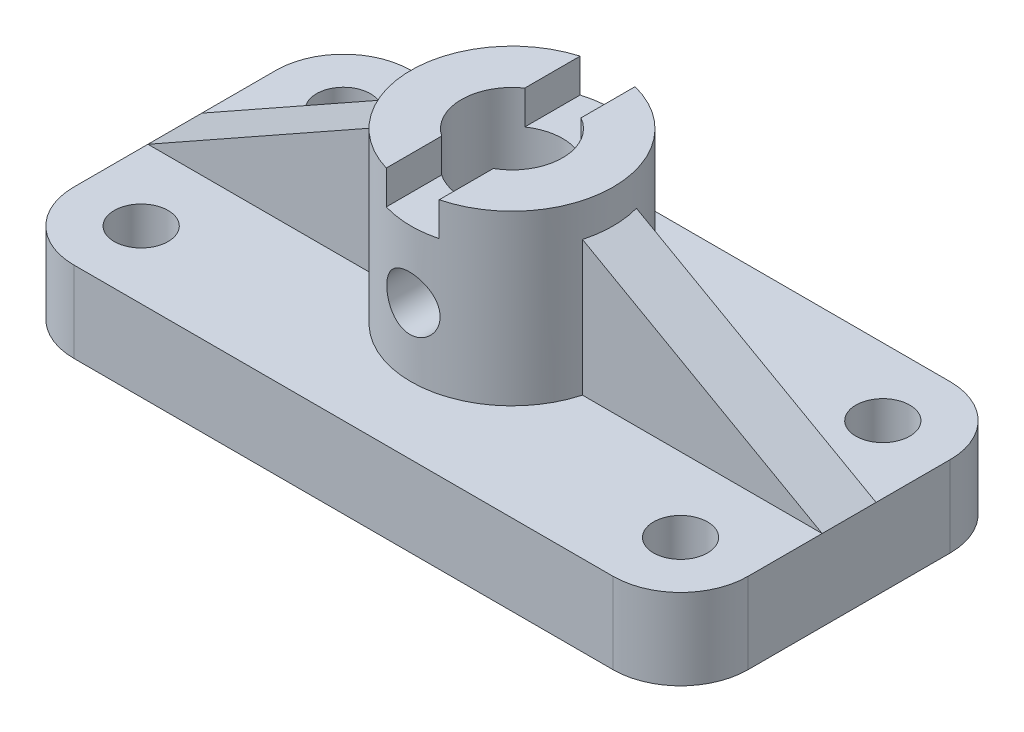
from build123d import *
from build123d.topology import SkipClean

# Parameters (mm, degrees)
SKETCH_1_R          = 4
EXTRUDE_1_DEPTH     = 12
EXTRUDE_3_DEPTH     = 25
CUT_EXTRUDE_START   = -5
CUT_EXTRUDE_2_DEPTH = 5
SKETCH_6_R          = 4
SKETCH_6_W          = 8
SKETCH_6_H          = 5
CUT_EXTRUDE_3_DEPTH = 69.62944
SKETCH_10_R         = 7.5
CUT_EXTRUDE_4_DEPTH = 68.037303


with BuildPart() as part:
    # 草图1 → 凸台-拉伸1 (new body)
    with BuildSketch(Plane(origin=(0, 0, 0), x_dir=(1, 0, 0), z_dir=(0, 1, 0))):
        with BuildLine():
            ThreePointArc((-40, 25), (-47.071068, 22.071068), (-50, 15))
            Line((-50, 15), (-50, -15))
            ThreePointArc((-50, -15), (-47.071068, -22.071068), (-40, -25))
            Line((-40, -25), (40, -25))
            ThreePointArc((40, -25), (47.071068, -22.071068), (50, -15))
            Line((50, -15), (50, 15))
            ThreePointArc((50, 15), (47.071068, 22.071068), (40, 25))
            Line((40, 25), (-40, 25))
        make_face()
        with Locations((-40, -15)):
            Circle(SKETCH_1_R, mode=Mode.SUBTRACT)
        with Locations((40, -15)):
            Circle(SKETCH_1_R, mode=Mode.SUBTRACT)
        with Locations((-40, 15)):
            Circle(SKETCH_1_R, mode=Mode.SUBTRACT)
        with Locations((40, 15)):
            Circle(SKETCH_1_R, mode=Mode.SUBTRACT)
    extrude(amount=EXTRUDE_1_DEPTH)

    # 草图3 → 凸台-拉伸3 (add)
    with BuildSketch(Plane(origin=(0, 12, 0), x_dir=(1, 0, 0), z_dir=(0, 1, 0))):
        with BuildLine():
            Line((-50, -4), (-14.456832, -4))
            ThreePointArc((-14.456832, -4), (15, 0), (-14.456832, 4))
            Line((-14.456832, 4), (-50, 4))
            Line((-50, 4), (-50, -4))
        make_face()
    extrude_3 = extrude(amount=EXTRUDE_3_DEPTH)

    # 草图7 → 切除-拉伸2 (cut)
    with SkipClean():  # the faces are left unmerged after this step: merging them gives an invalid solid
        with BuildSketch(Plane(origin=(0, 37, 0), x_dir=(1, 0, 0), z_dir=(0, 1, 0)).offset(CUT_EXTRUDE_START)):
            with BuildLine():
                Line((-14.456832, 4), (-50, 4))
                Line((-50, 4), (-50, -4))
                Line((-50, -4), (-14.456832, -4))
                ThreePointArc((-14.456832, -4), (-15, 0), (-14.456832, 4))
            make_face()
        cut_extrude_2 = extrude(amount=CUT_EXTRUDE_2_DEPTH, mode=Mode.SUBTRACT)

    # 草图6 → 切除-拉伸3 (cut, symmetric)
    with SkipClean():  # the faces are left unmerged after this step: merging them gives an invalid solid
        with BuildSketch(Plane.XY.offset(4)):
            with Locations((0.161482, 22)):
                Circle(SKETCH_6_R)
            Polygon((-14.456832, 32), (-50, 12), (-50, 32), align=None)
            with Locations((0.271584, 34.5)):
                Rectangle(SKETCH_6_W, SKETCH_6_H)
        cut_extrude_3 = extrude(amount=CUT_EXTRUDE_3_DEPTH, both=True, mode=Mode.SUBTRACT)

    # 镜向3: 凸台-拉伸3, 切除-拉伸2, 切除-拉伸3 across plane
    add(extrude_3.mirror(Plane(origin=(0, 0, 0), x_dir=(0, 0, 1), z_dir=(1, 0, 0))))
    add(cut_extrude_2.mirror(Plane(origin=(0, 0, 0), x_dir=(0, 0, 1), z_dir=(1, 0, 0))), mode=Mode.SUBTRACT)
    add(cut_extrude_3.mirror(Plane(origin=(0, 0, 0), x_dir=(0, 0, 1), z_dir=(1, 0, 0))), mode=Mode.SUBTRACT)

    # 草图10 → 切除-拉伸4 (cut, through all)
    with BuildSketch(Plane(origin=(0, 37, 0), x_dir=(1, 0, 0), z_dir=(0, 1, 0))):
        Circle(SKETCH_10_R)
    extrude(amount=-CUT_EXTRUDE_4_DEPTH, mode=Mode.SUBTRACT)


solid = part.part
